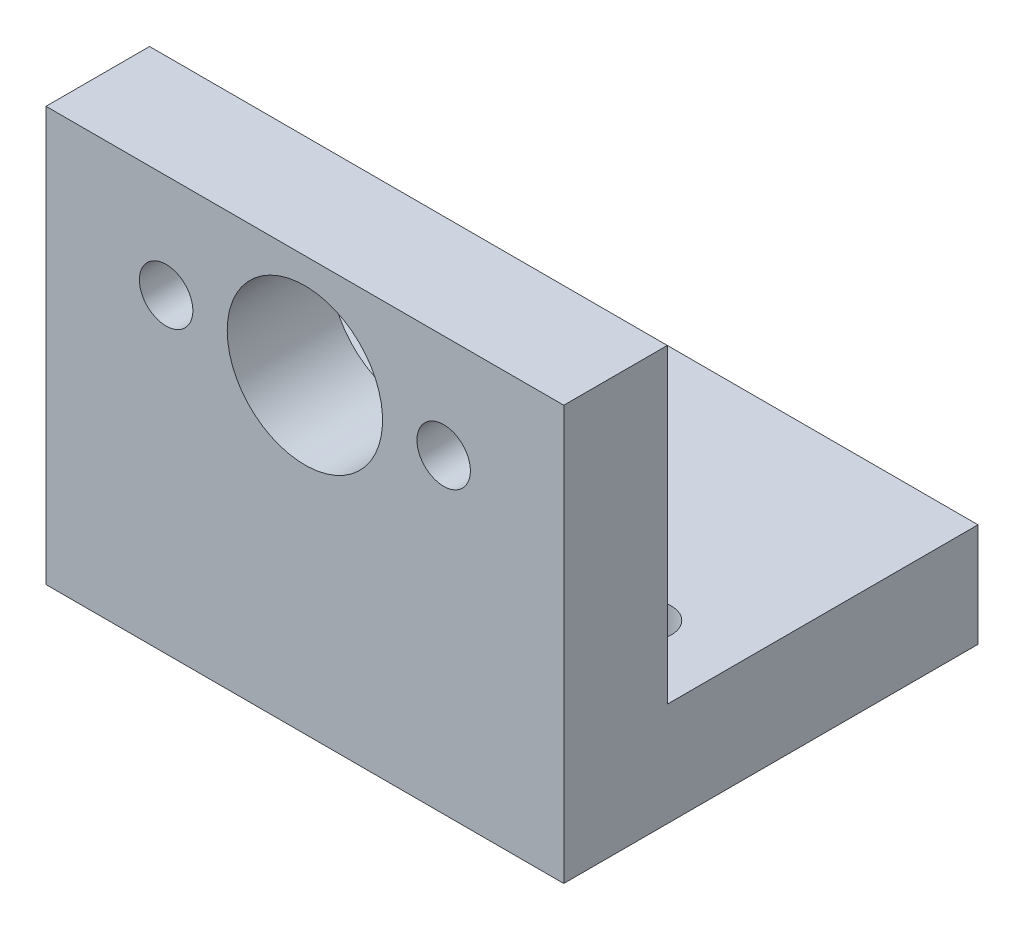
from build123d import *

# Parameters (mm, degrees)
BOSS_EXTRUDE1_DEPTH = 31.75
SKETCH3_R           = 4.7625
SKETCH3_R_2         = 1.6383
CUT_EXTRUDE1_DEPTH  = 45.901280605
SKETCH4_R           = 1.524
CUT_EXTRUDE2_DEPTH  = 45.901280605


with BuildPart() as part:
    # Sketch2 → Boss-Extrude1 (new body)
    with BuildSketch(Plane(origin=(0, 0, 0), x_dir=(0, 0, -1), z_dir=(1, 0, 0))):
        Polygon((0, 0), (25.4, 0), (25.4, 6.35), (6.35, 6.35), (6.35, 25.4), (0, 25.4), align=None)
    extrude(amount=BOSS_EXTRUDE1_DEPTH)

    # Sketch3 → Cut-Extrude1 (cut, through all)
    with BuildSketch(Plane(origin=(0, 0, -6.35), x_dir=(-1, 0, 0), z_dir=(0, 0, -1))):
        with Locations((-15.875, 19.05)):
            Circle(SKETCH3_R)
        with Locations((-7.366, 19.05)):
            Circle(SKETCH3_R_2)
        with Locations((-24.384, 19.05)):
            Circle(SKETCH3_R_2)
    extrude(amount=-CUT_EXTRUDE1_DEPTH, mode=Mode.SUBTRACT)

    # Sketch4 → Cut-Extrude2 (cut, through all)
    with BuildSketch(Plane(origin=(0, 6.35, 0), x_dir=(1, 0, 0), z_dir=(0, 1, 0))):
        with Locations((5.08, 21.59)):
            Circle(SKETCH4_R)
        with Locations((26.67, 10.16)):
            Circle(SKETCH4_R)
    extrude(amount=-CUT_EXTRUDE2_DEPTH, mode=Mode.SUBTRACT)


solid = part.part
